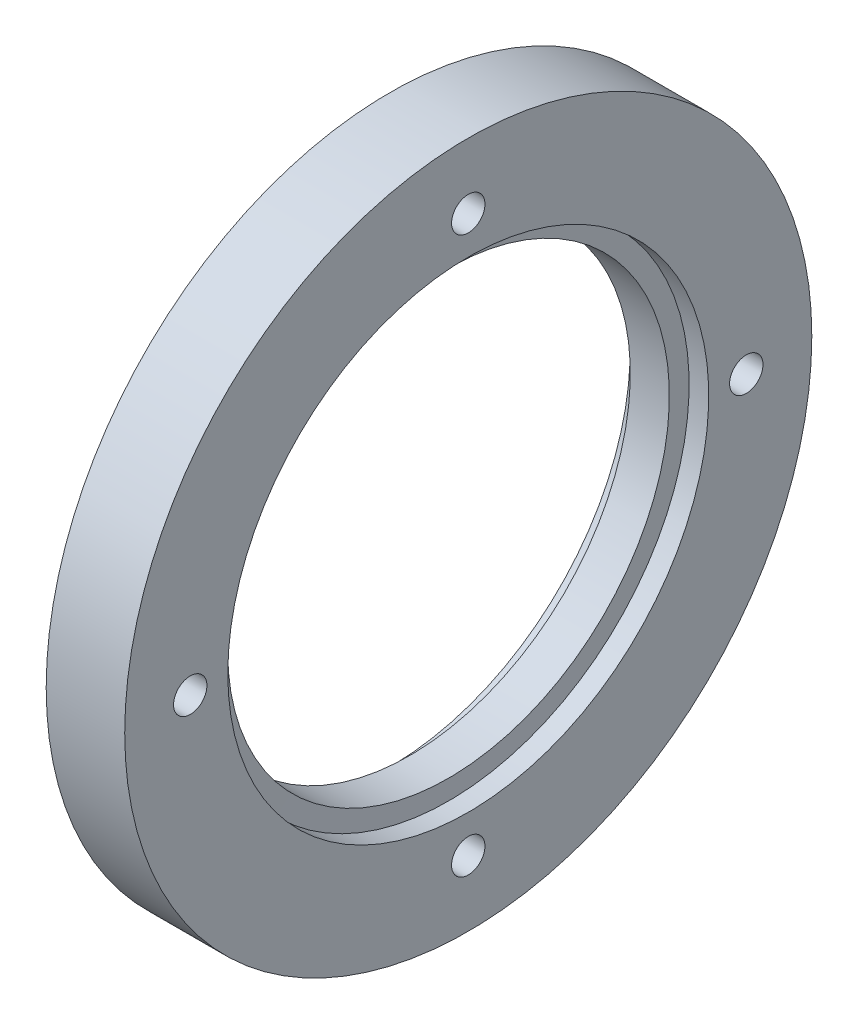
from build123d import *

# Parameters (mm, degrees)
M3_CLEARANCE_HOLE1_D     = 3.4
M3_CLEARANCE_HOLE1_DEPTH = 8
M3_CLEARANCE_HOLE1_TIP   = 1.021463052


with BuildPart() as part:
    # Sketch1 → Revolve17 (revolve)
    with BuildSketch(Plane.XY):
        Polygon((17.640221824, 24.5), (17.640221824, 35), (9.640221824, 35), (9.640221824, 24.5), (11.640221824, 24.5), (11.651946434, 22.500034367), (13.628497214, 22.500034367), (15.628497214, 22.500034367), (15.640221824, 24.5), align=None)
    revolve(axis=Axis((-801.920554309, 0, 0), (1, 0, 0)))

    # M3 Clearance Hole1
    with Locations(Plane.ZY.offset(-9.640221824)):
        with Locations((0, -28.325), (0, 28.325), (28.325, 0), (-28.325, 0)):
            Hole(M3_CLEARANCE_HOLE1_D / 2, depth=M3_CLEARANCE_HOLE1_DEPTH)
            with Locations((0, 0, -(M3_CLEARANCE_HOLE1_DEPTH + M3_CLEARANCE_HOLE1_TIP / 2))):  # 118° drill point
                Cone(0, M3_CLEARANCE_HOLE1_D / 2, M3_CLEARANCE_HOLE1_TIP, mode=Mode.SUBTRACT)


solid = part.part
